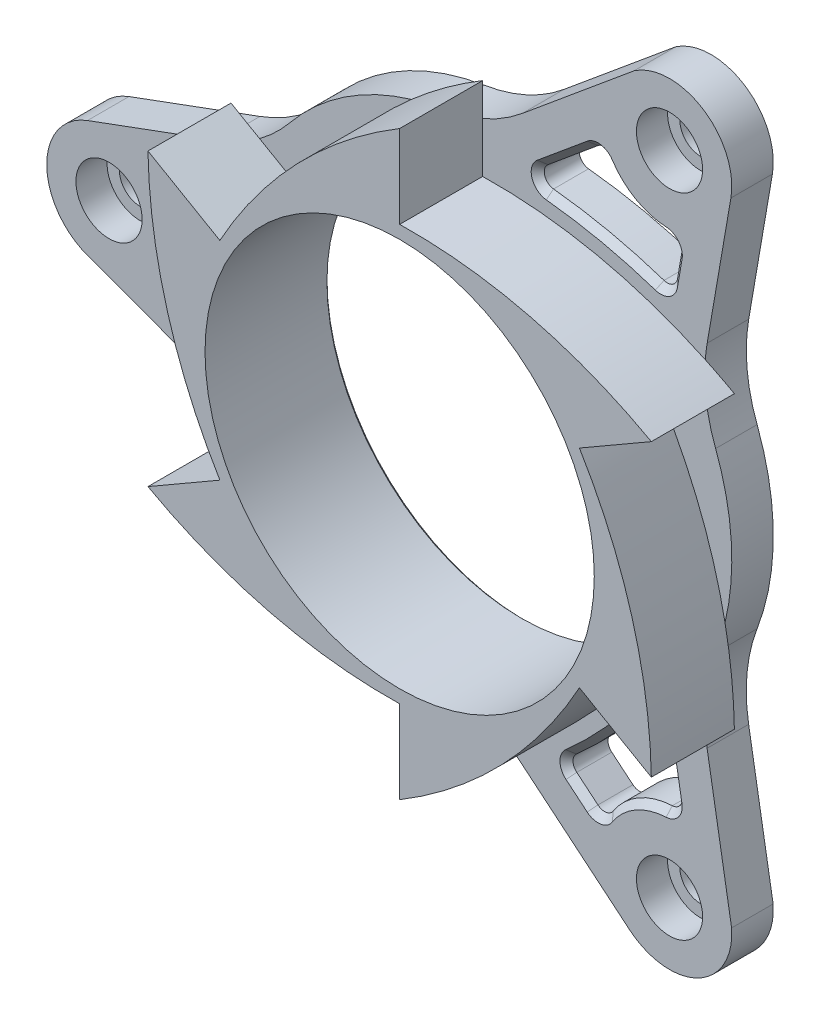
from build123d import *

# Parameters (mm, degrees)
BOSS_EXTRUDE1_DEPTH      = 6.35
BOSS_EXTRUDE1_DEPTH_BACK = 6.35
BOSS_EXTRUDE2_START      = -12.7
BOSS_EXTRUDE2_DEPTH      = 12.7
SKETCH5_R                = 28.575
SKETCH5_R_2              = 3.175
BOSS_EXTRUDE3_DEPTH      = 6.35
SKETCH4_R                = 29.76875
CUT_EXTRUDE1_DEPTH       = 92.058354791
FILLET1_R                = 25.4
CHAMFER1_SIZE            = 0.4
SKETCH6_R                = 5.0625
CUT_EXTRUDE2_DEPTH       = 4.7625
CHAMFER2_SIZE            = 0.4
CUT_EXTRUDE3_DEPTH       = 90.944491089
FILLET2_R                = 1.5875
CHAMFER3_SIZE            = 1


with BuildPart() as part:
    # Sketch1 → Boss-Extrude1 (new, two sides: drawn at the far end of the back side and taken through both)
    with BuildSketch(Plane.XY.offset(-BOSS_EXTRUDE1_DEPTH_BACK)):
        with BuildLine():
            Line((27.49630657, 15.875), (38.494829198, 22.225))
            ThreePointArc((38.494829198, 22.225), (19.878280804, 29.537115412), (0, 31.75))
            Line((0, 31.75), (0, 44.45))
            ThreePointArc((0, 44.45), (-15.640751899, 31.983653865), (-27.49630657, 15.875))
            Line((-27.49630657, 15.875), (-38.494829198, 22.225))
            ThreePointArc((-38.494829198, 22.225), (-35.519032703, 2.446538454), (-27.49630657, -15.875))
            Line((-27.49630657, -15.875), (-38.494829198, -22.225))
            ThreePointArc((-38.494829198, -22.225), (-19.878280804, -29.537115412), (0, -31.75))
            Line((0, -31.75), (0, -44.45))
            ThreePointArc((0, -44.45), (15.640751899, -31.983653865), (27.49630657, -15.875))
            Line((27.49630657, -15.875), (38.494829198, -22.225))
            ThreePointArc((38.494829198, -22.225), (35.519032703, -2.446538454), (27.49630657, 15.875))
        make_face()
        with BuildLine():
            ThreePointArc((-11.129967969, 17.779280801), (-16.817028225, 8.924127912), (-20.962292819, -0.749194604))
            ThreePointArc((-20.962292819, -0.749194604), (-16.137035591, -10.101909703), (-9.83232485, -18.528475405))
            ThreePointArc((-9.83232485, -18.528475405), (0.679992634, -19.026037615), (11.129967969, -17.779280801))
            ThreePointArc((11.129967969, -17.779280801), (16.817028225, -8.924127912), (20.962292819, 0.749194604))
            ThreePointArc((20.962292819, 0.749194604), (16.137035591, 10.101909703), (9.83232485, 18.528475405))
            ThreePointArc((9.83232485, 18.528475405), (-0.679992634, 19.026037615), (-11.129967969, 17.779280801))
        make_face(mode=Mode.SUBTRACT)
    extrude(amount=BOSS_EXTRUDE1_DEPTH + BOSS_EXTRUDE1_DEPTH_BACK)

    # Sketch3 → Boss-Extrude2 (add)
    with BuildSketch(Plane.XY.offset(6.35).offset(BOSS_EXTRUDE2_START)):
        with BuildLine():
            ThreePointArc((-11.129967969, 17.779280801), (-16.817028225, 8.924127912), (-20.962292819, -0.749194604))
            ThreePointArc((-20.962292819, -0.749194604), (-16.137035591, -10.101909703), (-9.83232485, -18.528475405))
            ThreePointArc((-9.83232485, -18.528475405), (0.679992634, -19.026037615), (11.129967969, -17.779280801))
            ThreePointArc((11.129967969, -17.779280801), (16.817028225, -8.924127912), (20.962292819, 0.749194604))
            ThreePointArc((20.962292819, 0.749194604), (16.137035591, 10.101909703), (9.83232485, 18.528475405))
            ThreePointArc((9.83232485, 18.528475405), (-0.679992634, 19.026037615), (-11.129967969, 17.779280801))
        make_face()
    extrude(amount=BOSS_EXTRUDE2_DEPTH)

    # Sketch5 → Boss-Extrude3 (add)
    with BuildSketch(Plane(origin=(0, 0, -6.35), x_dir=(-1, 0, 0), z_dir=(0, 0, -1))):
        with BuildLine():
            Line((32.995567884, 19.05), (60.442880134, 8.937704707))
            ThreePointArc((60.442880134, 8.937704707), (66.664871846, 0.439134102), (61.252121375, -8.596407693))
            Line((61.252121375, -8.596407693), (32.995567884, -19.05))
            ThreePointArc((32.995567884, -19.05), (19.05, -32.995567884), (0, -38.1))
            Line((0, -38.1), (-22.48116074, -56.813922027))
            ThreePointArc((-22.48116074, -56.813922027), (-32.952134635, -57.953039609), (-38.070768131, -48.7476893))
            Line((-38.070768131, -48.7476893), (-32.995567884, -19.05))
            ThreePointArc((-32.995567884, -19.05), (-38.1, 0), (-32.995567884, 19.05))
            Line((-32.995567884, 19.05), (-37.961719394, 47.876217321))
            ThreePointArc((-37.961719394, 47.876217321), (-33.712737211, 57.513905507), (-23.181353244, 57.344096993))
            Line((-23.181353244, 57.344096993), (0, 38.1))
            ThreePointArc((0, 38.1), (19.05, 32.995567884), (32.995567884, 19.05))
        make_face()
        Circle(SKETCH5_R, mode=Mode.SUBTRACT)
        with Locations((57.15, 0)):
            Circle(SKETCH5_R_2, mode=Mode.SUBTRACT)
        with Locations((-28.575, -49.493351826)):
            Circle(SKETCH5_R_2, mode=Mode.SUBTRACT)
        with Locations((-28.575, 49.493351826)):
            Circle(SKETCH5_R_2, mode=Mode.SUBTRACT)
    extrude(amount=BOSS_EXTRUDE3_DEPTH)

    # Sketch4 → Cut-Extrude1 (cut, through all)
    with BuildSketch(Plane.XY.offset(6.35)):
        Circle(SKETCH4_R)
    extrude(amount=-CUT_EXTRUDE1_DEPTH, mode=Mode.SUBTRACT)

    # Fillet1
    # the kernel refuses this fillet: 25.4 mm, written as the material it adds along each edge
    with BuildSketch(Plane(origin=(-32.995567884, 19.05, -6.35), x_dir=(0.5679840694652307, 0.8230395475514625, 0), z_dir=(0, 0, -1)), Plane(origin=(32.995567884, 19.05, -6.35), x_dir=(0.4287811217662027, -0.9034084068774858, 0), z_dir=(0, 0, -1))) as fillet1_piece_1:
        with BuildLine():
            CenterArc((8.165476108, -25.317835857), FILLET1_R, 94.609768089, 30.555369821)
            Line((-6.46327317, -4.553450613), (0, 0))
            ThreePointArc((0, 0), (3.06205354, -0.123246214), (6.124107081, 0))
        make_face()
    extrude(amount=6.35)
    with BuildSketch(Plane(origin=(0, 38.1, -6.35), x_dir=(0.7694229347435713, 0.6387396554861691, 0), z_dir=(0, 0, -1))) as fillet1_piece_2:
        with BuildLine():
            CenterArc((7.890053064, -25.4), FILLET1_R, 90, 30.497222757)
            ThreePointArc((-5.000360511, -3.513994475), (-2.429606735, -1.857422281), (0, 0))
            Line((0, 0), (7.890053064, 0))
        make_face()
    extrude(amount=6.35)
    with BuildSketch(Plane(origin=(32.995567884, -19.05, -6.35), x_dir=(0.4289297721081339, 0.9033378385738441, 0), z_dir=(0, 0, -1)), Plane(origin=(-32.995567884, -19.05, -6.35), x_dir=(0.5678486303506066, -0.8231329983720371, 0), z_dir=(0, 0, -1))) as fillet1_piece_3:
        with BuildLine():
            CenterArc((8.148811765, 25.318171422), FILLET1_R, 234.902437193, 30.497222757)
            Line((-6.455437662, 4.536547359), (0, 0))
            ThreePointArc((0, 0), (3.055804412, 0.122742866), (6.111608823, 0))
        make_face()
    extrude(amount=6.35)
    with BuildSketch(Plane(origin=(0, -38.1, -6.35), x_dir=(0.7685638006263528, -0.6397731507079489, 0), z_dir=(0, 0, -1))) as fillet1_piece_4:
        with BuildLine():
            CenterArc((7.906188245, 25.4), FILLET1_R, 239.444630179, 30.555369821)
            ThreePointArc((-5.00642987, 3.527087678), (-2.432233125, 1.864297062), (0, 0))
            Line((0, 0), (7.906188245, 0))
        make_face()
    extrude(amount=6.35)

    # Chamfer1
    chamfer1_edges = [part.edges().sort_by_distance(p)[0] for p in [
        (-29.76875, 0, -12.7),
    ]]
    chamfer(chamfer1_edges, length=CHAMFER1_SIZE)

    # Sketch6 → Cut-Extrude2 (cut)
    with BuildSketch(Plane.XY.offset(-6.35)):
        with Locations((-57.15, 0)):
            Circle(SKETCH6_R)
        with Locations((28.575, 49.493351826)):
            Circle(SKETCH6_R)
        with Locations((28.575, -49.493351826)):
            Circle(SKETCH6_R)
    extrude(amount=-CUT_EXTRUDE2_DEPTH, mode=Mode.SUBTRACT)

    # Chamfer2
    chamfer2_edges = [part.edges().sort_by_distance(p)[0] for p in [
        (-53.975, 0, -12.7),
        (31.75, -49.493351826, -12.7),
        (31.75, 49.493351826, -12.7),
    ]]
    chamfer(chamfer2_edges, length=CHAMFER2_SIZE)

    # Sketch7 → Cut-Extrude3 (cut, through all)
    with BuildSketch(Plane.XY.offset(-6.35)):
        with BuildLine():
            Line((-47.961564045, 6.768884764), (-40.432039151, 9.542955262))
            ThreePointArc((-40.432039151, 9.542955262), (-37.581871463, -1.604597976), (-33.149081766, -12.222590938))
            Line((-33.149081766, -12.222590938), (-47.946416792, -6.748274771))
            ThreePointArc((-47.946416792, -6.748274771), (-45.737507166, 0.012788775), (-47.961564045, 6.768884764))
        make_face()
        with BuildLine():
            Line((18.129031012, 44.896952348), (5.989466631, 34.819242391))
            ThreePointArc((5.989466631, 34.819242391), (17.401313122, 33.349154397), (28.480461259, 30.2436954))
            Line((28.480461259, 30.2436954), (29.842808184, 38.151490486))
            ThreePointArc((29.842808184, 38.151490486), (22.879828987, 39.603448724), (18.129031012, 44.896952348))
        make_face()
        with BuildLine():
            Line((29.81738578, -38.148677577), (27.159615136, -22.596651453))
            ThreePointArc((27.159615136, -22.596651453), (20.180558341, -31.744556421), (11.951577891, -39.786650662))
            Line((11.951577891, -39.786650662), (18.118755861, -44.920375251))
            ThreePointArc((18.118755861, -44.920375251), (22.857678179, -39.616237499), (29.81738578, -38.148677577))
        make_face()
    extrude(amount=-CUT_EXTRUDE3_DEPTH, mode=Mode.SUBTRACT)

    # Fillet2
    fillet2_edges = [part.edges().sort_by_distance(p)[0] for p in [
        (-47.946416792, -6.748274771, -9.525),
        (-47.961564045, 6.768884764, -9.525),
        (-40.432039151, 9.542955262, -9.525),
        (-33.149081766, -12.222590938, -9.525),
        (18.129031012, 44.896952348, -9.525),
        (29.842808184, 38.151490486, -9.525),
        (28.480461259, 30.2436954, -9.525),
        (5.989466631, 34.819242391, -9.525),
        (29.81738578, -38.148677577, -9.525),
        (18.118755861, -44.920375251, -9.525),
        (11.951577891, -39.786650662, -9.525),
        (27.159615136, -22.596651453, -9.525),
    ]]
    fillet(fillet2_edges, radius=FILLET2_R)

    # Chamfer3
    chamfer3_edges = [part.edges().sort_by_distance(p)[0] for p in [
        (28.654203349, -31.342280047, -6.35),
        (22.860336554, -39.614699188, -6.35),
        (15.008329488, -42.331172794, -6.35),
        (19.509559058, -32.493386009, -6.35),
        (18.385318209, 33.142466765, -6.35),
        (12.816109058, 40.486408049, -6.35),
        (29.155706267, 34.163181002, -6.35),
        (22.877167584, 39.604981789, -6.35),
        (-44.164035756, 8.167991792, -6.35),
        (-37.894877267, -0.649080756, -6.35),
        (-45.737504137, 0.0097174, -6.35),
        (-41.470312408, -9.144128002, -6.35),
        (29.165300736, -37.502571094, -6.35),
        (17.883815014, -44.027740319, -6.35),
        (26.612841241, -25.16392107, -6.35),
        (12.817816331, -39.787704437, -6.35),
        (8.486174285, 35.629357117, -6.35),
        (28.048254636, 30.994406782, -6.35),
        (29.18723408, 37.501708279, -6.35),
        (17.895528907, 44.009176894, -6.35),
        (-40.866070966, 8.793297655, -6.35),
        (-47.071049095, 6.52603204, -6.35),
        (-47.060829643, -6.506605799, -6.35),
        (-35.099015526, -10.465436046, -6.35),
    ]]
    chamfer(chamfer3_edges, length=CHAMFER3_SIZE)


solid = part.part
